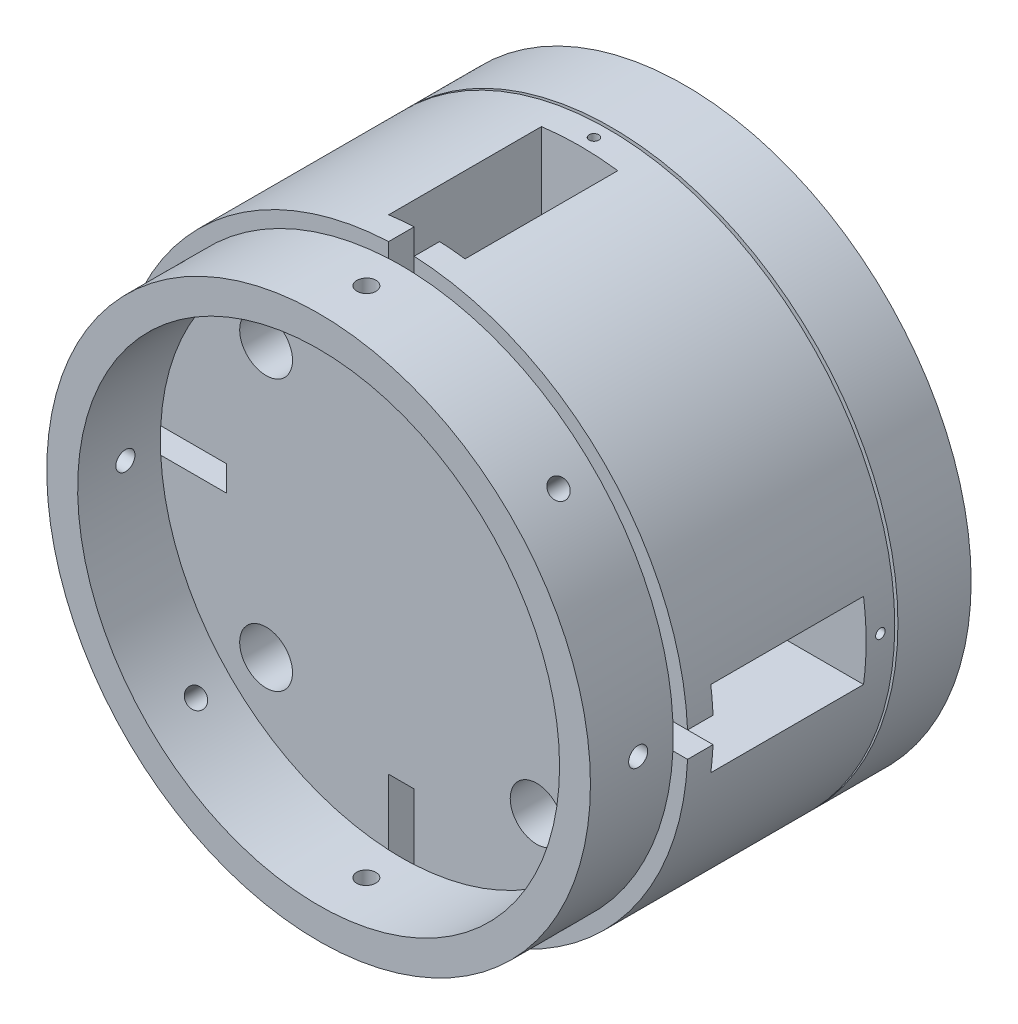
from build123d import *
from build123d.topology import SkipClean

# Parameters (mm, degrees)
SKETCH_1_R                = 45
EXTRUDE_1_DEPTH           = 2.5
EXTRUDE_START             = 26
SKETCH_2_R                = 9
SKETCH_2_R_2              = 4.05
EXTRUDE_2_DEPTH           = 26
CUT_EXTRUDE_4_DEPTH       = 30
CUT_EXTRUDE_4_DEPTH_BACK  = 10
SKETCH_2_5_R              = 4.05
SKETCH_11_R               = 42.7
SKETCH_11_R_2             = 37.85
EXTRUDE_5_DEPTH           = 11
CUT_EXTRUDE_5_DEPTH       = 50
CUT_EXTRUDE_5_DEPTH_BACK  = 50
SKETCH_12_R               = 1.5
CUT_EXTRUDE_6_DEPTH       = 50
CUT_EXTRUDE_6_DEPTH_BACK  = 50
SKETCH_13_R               = 1.5
CUT_EXTRUDE_7_DEPTH       = 50
CUT_EXTRUDE_7_DEPTH_BACK  = 50
SKETCH_18_R               = 1.5
CUT_EXTRUDE_8_DEPTH       = 50
CUT_EXTRUDE_8_DEPTH_BACK  = 50
SKETCH_19_R               = 1.5
EXTRUDE_START_2           = 2
EXTRUDE_7_DEPTH           = 2
EXTRUDE_START_3           = 30
EXTRUDE_8_DEPTH           = 30
SKETCH_29_R               = 45.149779355
EXTRUDE_9_DEPTH           = 4
EXTRUDE_START_4           = 11
SKETCH_30_R               = 42.7
SKETCH_30_R_2             = 37.85
EXTRUDE_10_DEPTH          = 11
SKETCH_31_R               = 47.052447184
SKETCH_31_R_2             = 45
CUT_EXTRUDE_9_DEPTH       = 40
CUT_EXTRUDE_10_DEPTH      = 4
CUT_EXTRUDE_11_DEPTH      = 50
CUT_EXTRUDE_11_DEPTH_BACK = 50
SKETCH_35_R               = 1.5
CUT_EXTRUDE_12_DEPTH      = 50
CUT_EXTRUDE_12_DEPTH_BACK = 50
SKETCH_36_R               = 1.5
CUT_EXTRUDE_13_DEPTH      = 50
CUT_EXTRUDE_13_DEPTH_BACK = 50
SKETCH_37_R               = 1.5
CUT_EXTRUDE_14_DEPTH      = 50
CUT_EXTRUDE_14_DEPTH_BACK = 50
SKETCH_38_R               = 1.5
SKETCH_39_R               = 42.7
SKETCH_39_R_2             = 37.85
EXTRUDE_11_DEPTH          = 1
SKETCH_41_R               = 0.75
SKETCH_41_R_2             = 1
CUT_EXTRUDE_15_DEPTH      = 8
CUT_EXTRUDE_START         = -8
SKETCH_42_R               = 0.75
CUT_EXTRUDE_21_DEPTH      = 8
CUT_EXTRUDE_22_DEPTH      = 8
CUT_EXTRUDE_23_DEPTH      = 8
EXTRUDE_START_5           = -32
EXTRUDE_12_DEPTH          = 32
CUT_EXTRUDE_START_2       = -35
SKETCH_47_R               = 5
CUT_EXTRUDE_24_DEPTH      = 35
SKETCH_49_R               = 4.05
CUT_EXTRUDE_25_DEPTH      = 35
SKETCH_50_R               = 4.15
CUT_EXTRUDE_26_DEPTH      = 50
SKETCH_54_R               = 42.7
SKETCH_54_R_2             = 37.85
EXTRUDE_13_DEPTH          = 2
SKETCH_55_R               = 45
SKETCH_55_R_2             = 43.2
EXTRUDE_14_DEPTH          = 11.5


with BuildPart() as part:
    # 草图1 → 凸台-拉伸1 (new body)
    with BuildSketch(Plane.XY):
        Circle(SKETCH_1_R)
    extrude(amount=-EXTRUDE_1_DEPTH)

    # 草图2 → 凸台-拉伸2 (add)
    # profile 1 of 5: a face of its own
    with BuildSketch(Plane.XY.offset(EXTRUDE_START)):
        with BuildLine():
            ThreePointArc((-44.18993098, 8.5), (-44.411663196, 7.252873374), (-44.598206242, 6))
            Line((-44.598206242, 6), (-25, 6))
            Line((-25, 6), (-25, -6))
            Line((-25, -6), (-44.598206242, -6))
            ThreePointArc((-44.598206242, -6), (-44.411663196, -7.252873374), (-44.18993098, -8.5))
            Line((-44.18993098, -8.5), (-23, -8.5))
            Line((-23, -8.5), (-23, -3))
            Line((-23, -3), (-3, -3))
            Line((-3, -3), (-3, -23))
            Line((-3, -23), (-8.5, -23))
            Line((-8.5, -23), (-8.5, -44.18993098))
            ThreePointArc((-8.5, -44.18993098), (-7.252873374, -44.411663196), (-6, -44.598206242))
            Line((-6, -44.598206242), (-6, -25))
            Line((-6, -25), (6, -25))
            Line((6, -25), (6, -44.598206242))
            ThreePointArc((6, -44.598206242), (7.252873374, -44.411663196), (8.5, -44.18993098))
            Line((8.5, -44.18993098), (8.5, -23))
            Line((8.5, -23), (3, -23))
            Line((3, -23), (3, -3))
            Line((3, -3), (23, -3))
            Line((23, -3), (23, -8.5))
            Line((23, -8.5), (44.18993098, -8.5))
            ThreePointArc((44.18993098, -8.5), (44.411663196, -7.252873374), (44.598206242, -6))
            Line((44.598206242, -6), (25, -6))
            Line((25, -6), (25, 6))
            Line((25, 6), (44.598206242, 6))
            ThreePointArc((44.598206242, 6), (44.411663196, 7.252873374), (44.18993098, 8.5))
            Line((44.18993098, 8.5), (23, 8.5))
            Line((23, 8.5), (23, 3))
            Line((23, 3), (3, 3))
            Line((3, 3), (3, 23))
            Line((3, 23), (8.5, 23))
            Line((8.5, 23), (8.5, 44.18993098))
            ThreePointArc((8.5, 44.18993098), (7.252873374, 44.411663196), (6, 44.598206242))
            Line((6, 44.598206242), (6, 25))
            Line((6, 25), (-6, 25))
            Line((-6, 25), (-6, 44.598206242))
            ThreePointArc((-6, 44.598206242), (-7.252873374, 44.411663196), (-8.5, 44.18993098))
            Line((-8.5, 44.18993098), (-8.5, 23))
            Line((-8.5, 23), (-3, 23))
            Line((-3, 23), (-3, 3))
            Line((-3, 3), (-23, 3))
            Line((-23, 3), (-23, 8.5))
            Line((-23, 8.5), (-44.18993098, 8.5))
        make_face()
    # profile 2 of 5: a face of its own
    with BuildSketch(Plane.XY.offset(EXTRUDE_START)):
        with Locations((-21.25, 21.25)):
            Circle(SKETCH_2_R)
        with Locations((-21.25, 21.25)):
            Circle(SKETCH_2_R_2, mode=Mode.SUBTRACT)
    # profile 3 of 5: a face of its own
    with BuildSketch(Plane.XY.offset(EXTRUDE_START)):
        with Locations((-21.25, -21.25)):
            Circle(SKETCH_2_R)
        with Locations((-21.25, -21.25)):
            Circle(SKETCH_2_R_2, mode=Mode.SUBTRACT)
    # profile 4 of 5: a face of its own
    with BuildSketch(Plane.XY.offset(EXTRUDE_START)):
        with Locations((21.25, 21.25)):
            Circle(SKETCH_2_R)
        with Locations((21.25, 21.25)):
            Circle(SKETCH_2_R_2, mode=Mode.SUBTRACT)
    # profile 5 of 5: a face of its own
    with BuildSketch(Plane.XY.offset(EXTRUDE_START)):
        with Locations((21.25, -21.25)):
            Circle(SKETCH_2_R)
        with Locations((21.25, -21.25)):
            Circle(SKETCH_2_R_2, mode=Mode.SUBTRACT)
    extrude(amount=-EXTRUDE_2_DEPTH)

    # 草图2<5> → 切除-拉伸4 (cut, two sides: drawn at the far end of the back side and taken through both)
    with BuildSketch(Plane.XY.offset(-CUT_EXTRUDE_4_DEPTH_BACK)):
        with Locations((-21.25, 21.25)):
            Circle(SKETCH_2_5_R)
        with Locations((-21.25, -21.25)):
            Circle(SKETCH_2_5_R)
        with Locations((21.25, 21.25)):
            Circle(SKETCH_2_5_R)
        with Locations((21.25, -21.25)):
            Circle(SKETCH_2_5_R)
    extrude(amount=CUT_EXTRUDE_4_DEPTH + CUT_EXTRUDE_4_DEPTH_BACK, mode=Mode.SUBTRACT)

    # 草图11 → 凸台-拉伸5 (add)
    with BuildSketch(Plane(origin=(0, 0, -2.5), x_dir=(-1, 0, 0), z_dir=(0, 0, -1))):
        Circle(SKETCH_11_R)
        Circle(SKETCH_11_R_2, mode=Mode.SUBTRACT)
    extrude(amount=EXTRUDE_5_DEPTH)

    # 草图12 → 切除-拉伸5 (cut, two sides: drawn at the far end of the back side and taken through both)
    with BuildSketch(Plane(origin=(0, 0, 0), x_dir=(1, 0, 0), z_dir=(0, 1, 0)).offset(-CUT_EXTRUDE_5_DEPTH_BACK)):
        with Locations((0, 8.75)):
            Circle(SKETCH_12_R)
    extrude(amount=CUT_EXTRUDE_5_DEPTH + CUT_EXTRUDE_5_DEPTH_BACK, mode=Mode.SUBTRACT)

    # 草图13 → 切除-拉伸6 (cut, two sides: drawn at the far end of the back side and taken through both)
    with BuildSketch(Plane(origin=(0, 0, 0), x_dir=(0, 0, -1), z_dir=(1, 0, 0)).offset(-CUT_EXTRUDE_6_DEPTH_BACK)):
        with Locations((8.75, 0)):
            Circle(SKETCH_13_R)
    extrude(amount=CUT_EXTRUDE_6_DEPTH + CUT_EXTRUDE_6_DEPTH_BACK, mode=Mode.SUBTRACT)

    # 草图18 → 切除-拉伸7 (cut, two sides: drawn at the far end of the back side and taken through both)
    with BuildSketch(Plane(origin=(0, 0, 0), x_dir=(0, 0, 1), z_dir=(0.7071067811865464, 0.7071067811865488, 0)).offset(-CUT_EXTRUDE_7_DEPTH_BACK)):
        with Locations((-8.75, 0)):
            Circle(SKETCH_18_R)
    extrude(amount=CUT_EXTRUDE_7_DEPTH + CUT_EXTRUDE_7_DEPTH_BACK, mode=Mode.SUBTRACT)

    # 草图19 → 切除-拉伸8 (cut, two sides: drawn at the far end of the back side and taken through both)
    with BuildSketch(Plane(origin=(0, 0, 0), x_dir=(0, 0, 1), z_dir=(-0.7071067811865512, 0.7071067811865439, 0)).offset(-CUT_EXTRUDE_8_DEPTH_BACK)):
        with Locations((-8.75, 0)):
            Circle(SKETCH_19_R)
    extrude(amount=CUT_EXTRUDE_8_DEPTH + CUT_EXTRUDE_8_DEPTH_BACK, mode=Mode.SUBTRACT)

    # 草图24 → 凸台-拉伸7 (add)
    with BuildSketch(Plane.XY.offset(EXTRUDE_START_2)):
        with BuildLine():
            Line((-6, 44.598206242), (-6, 25))
            Line((-6, 25), (6, 25))
            Line((6, 25), (6, 44.598206242))
            ThreePointArc((6, 44.598206242), (0, 45), (-6, 44.598206242))
        make_face()
        with BuildLine():
            Line((44.598206242, 6), (25, 6))
            Line((25, 6), (25, -6))
            Line((25, -6), (44.598206242, -6))
            ThreePointArc((44.598206242, -6), (45, 0), (44.598206242, 6))
        make_face()
        with BuildLine():
            Line((6, -44.598206242), (6, -25))
            Line((6, -25), (-6, -25))
            Line((-6, -25), (-6, -44.598206242))
            ThreePointArc((-6, -44.598206242), (0, -45), (6, -44.598206242))
        make_face()
        with BuildLine():
            Line((-44.598206242, -6), (-25, -6))
            Line((-25, -6), (-25, 6))
            Line((-25, 6), (-44.598206242, 6))
            ThreePointArc((-44.598206242, 6), (-45, 0), (-44.598206242, -6))
        make_face()
    extrude(amount=-EXTRUDE_7_DEPTH)

    # 草图26 → 凸台-拉伸8 (add)
    with SkipClean():  # the faces are left unmerged after this step: merging them gives an invalid solid
        with BuildSketch(Plane.XY.offset(EXTRUDE_START_3)):
            with BuildLine():
                Line((-8.5, 42.151512428), (-8.5, 44.18993098))
                ThreePointArc((-8.5, 44.18993098), (-31.819805153, 31.819805153), (-44.18993098, 8.5))
                Line((-44.18993098, 8.5), (-42.151512428, 8.5))
                ThreePointArc((-42.151512428, 8.5), (-30.405591591, 30.405591591), (-8.5, 42.151512428))
            make_face()
            with BuildLine():
                Line((8.5, 42.151512428), (8.5, 44.18993098))
                ThreePointArc((8.5, 44.18993098), (31.819805153, 31.819805153), (44.18993098, 8.5))
                Line((44.18993098, 8.5), (42.151512428, 8.5))
                ThreePointArc((42.151512428, 8.5), (30.405591591, 30.405591591), (8.5, 42.151512428))
            make_face()
            with BuildLine():
                Line((42.151512428, -8.5), (44.18993098, -8.5))
                ThreePointArc((44.18993098, -8.5), (31.819805153, -31.819805153), (8.5, -44.18993098))
                Line((8.5, -44.18993098), (8.5, -42.151512428))
                ThreePointArc((8.5, -42.151512428), (30.405591591, -30.405591591), (42.151512428, -8.5))
            make_face()
            with BuildLine():
                Line((-8.5, -42.151512428), (-8.5, -44.18993098))
                ThreePointArc((-8.5, -44.18993098), (-31.819805153, -31.819805153), (-44.18993098, -8.5))
                Line((-44.18993098, -8.5), (-42.151512428, -8.5))
                ThreePointArc((-42.151512428, -8.5), (-30.405591591, -30.405591591), (-8.5, -42.151512428))
            make_face()
        extrude(amount=-EXTRUDE_8_DEPTH)

    # 草图29 → 凸台-拉伸9 (add)
    with SkipClean():  # the faces are left unmerged after this step: merging them gives an invalid solid
        with BuildSketch(Plane.XY.offset(26)):
            Circle(SKETCH_29_R)
        extrude(amount=EXTRUDE_9_DEPTH)

    # 草图30 → 凸台-拉伸10 (add)
    with SkipClean():  # the faces are left unmerged after this step: merging them gives an invalid solid
        with BuildSketch(Plane.XY.offset(30).offset(EXTRUDE_START_4)):
            Circle(SKETCH_30_R)
            Circle(SKETCH_30_R_2, mode=Mode.SUBTRACT)
        extrude(amount=-EXTRUDE_10_DEPTH)

    # 草图31 → 切除-拉伸9 (cut)
    with SkipClean():  # the faces are left unmerged after this step: merging them gives an invalid solid
        with BuildSketch(Plane.XY.offset(30)):
            Circle(SKETCH_31_R)
            Circle(SKETCH_31_R_2, mode=Mode.SUBTRACT)
        extrude(amount=-CUT_EXTRUDE_9_DEPTH, mode=Mode.SUBTRACT)

    # 草图32 → 切除-拉伸10 (cut)
    with SkipClean():  # the faces are left unmerged after this step: merging them gives an invalid solid
        with BuildSketch(Plane.XY.offset(30)):
            with BuildLine():
                Line((-2, 27.5), (2, 27.5))
                Line((2, 27.5), (2, 44.955533586))
                ThreePointArc((2, 44.955533586), (0, 45), (-2, 44.955533586))
                Line((-2, 44.955533586), (-2, 27.5))
            make_face()
            with BuildLine():
                Line((-44.955533586, -2), (-27.5, -2))
                Line((-27.5, -2), (-27.5, 2))
                Line((-27.5, 2), (-44.955533586, 2))
                ThreePointArc((-44.955533586, 2), (-45, 0), (-44.955533586, -2))
            make_face()
            with BuildLine():
                Line((27.5, -2), (44.955533586, -2))
                ThreePointArc((44.955533586, -2), (45, 0), (44.955533586, 2))
                Line((44.955533586, 2), (27.5, 2))
                Line((27.5, 2), (27.5, -2))
            make_face()
            with BuildLine():
                Line((2, -44.955533586), (2, -27.5))
                Line((2, -27.5), (-2, -27.5))
                Line((-2, -27.5), (-2, -44.955533586))
                ThreePointArc((-2, -44.955533586), (0, -45), (2, -44.955533586))
            make_face()
        extrude(amount=-CUT_EXTRUDE_10_DEPTH, mode=Mode.SUBTRACT)

    # 草图35 → 切除-拉伸11 (cut, two sides: drawn at the far end of the back side and taken through both)
    with SkipClean():  # the faces are left unmerged after this step: merging them gives an invalid solid
        with BuildSketch(Plane(origin=(0, 0, 0), x_dir=(0, 0, -1), z_dir=(1, 0, 0)).offset(-CUT_EXTRUDE_11_DEPTH_BACK)):
            with Locations((-35.5, 0)):
                Circle(SKETCH_35_R)
        extrude(amount=CUT_EXTRUDE_11_DEPTH + CUT_EXTRUDE_11_DEPTH_BACK, mode=Mode.SUBTRACT)

    # 草图36 → 切除-拉伸12 (cut, two sides: drawn at the far end of the back side and taken through both)
    with SkipClean():  # the faces are left unmerged after this step: merging them gives an invalid solid
        with BuildSketch(Plane(origin=(0, 0, 0), x_dir=(1, 0, 0), z_dir=(0, 1, 0)).offset(-CUT_EXTRUDE_12_DEPTH_BACK)):
            with Locations((0, -35.5)):
                Circle(SKETCH_36_R)
        extrude(amount=CUT_EXTRUDE_12_DEPTH + CUT_EXTRUDE_12_DEPTH_BACK, mode=Mode.SUBTRACT)

    # 草图37 → 切除-拉伸13 (cut, two sides: drawn at the far end of the back side and taken through both)
    with SkipClean():  # the faces are left unmerged after this step: merging them gives an invalid solid
        with BuildSketch(Plane(origin=(0, 0, 0), x_dir=(0, 0, 1), z_dir=(0.7071067811865464, 0.7071067811865488, 0)).offset(-CUT_EXTRUDE_13_DEPTH_BACK)):
            with Locations((35.5, 0)):
                Circle(SKETCH_37_R)
        extrude(amount=CUT_EXTRUDE_13_DEPTH + CUT_EXTRUDE_13_DEPTH_BACK, mode=Mode.SUBTRACT)

    # 草图38 → 切除-拉伸14 (cut, two sides: drawn at the far end of the back side and taken through both)
    with SkipClean():  # the faces are left unmerged after this step: merging them gives an invalid solid
        with BuildSketch(Plane(origin=(0, 0, 0), x_dir=(0, 0, 1), z_dir=(-0.7071067811865512, 0.7071067811865439, 0)).offset(-CUT_EXTRUDE_14_DEPTH_BACK)):
            with Locations((35.5, 0)):
                Circle(SKETCH_38_R)
        extrude(amount=CUT_EXTRUDE_14_DEPTH + CUT_EXTRUDE_14_DEPTH_BACK, mode=Mode.SUBTRACT)

    # 草图39 → 凸台-拉伸11 (add)
    with SkipClean():  # the faces are left unmerged after this step: merging them gives an invalid solid
        with BuildSketch(Plane(origin=(0, 0, -13.5), x_dir=(-1, 0, 0), z_dir=(0, 0, -1))):
            Circle(SKETCH_39_R)
            Circle(SKETCH_39_R_2, mode=Mode.SUBTRACT)
        extrude(amount=EXTRUDE_11_DEPTH)

    # 草图41 → 切除-拉伸15 (cut)
    with SkipClean():  # the faces are left unmerged after this step: merging them gives an invalid solid
        with BuildSketch(Plane(origin=(45, 0, 0), x_dir=(0, 0, -1), z_dir=(1, 0, 0))):
            with Locations((0.25, 0)):
                Circle(SKETCH_41_R)
            with Locations((-28.25, 0)):
                Circle(SKETCH_41_R_2)
        extrude(amount=-CUT_EXTRUDE_15_DEPTH, mode=Mode.SUBTRACT)

    # 草图42 → 切除-拉伸21 (cut)
    with SkipClean():  # the faces are left unmerged after this step: merging them gives an invalid solid
        with BuildSketch(Plane.ZY.offset(45).offset(CUT_EXTRUDE_START)):
            with Locations((-0.25, 0)):
                Circle(SKETCH_42_R)
        extrude(amount=CUT_EXTRUDE_21_DEPTH, mode=Mode.SUBTRACT)

    # 草图43 → 切除-拉伸22 (cut)
    with SkipClean():  # the faces are left unmerged after this step: merging them gives an invalid solid
        with BuildSketch(Plane(origin=(0, 45, 0), x_dir=(1, 0, 0), z_dir=(0, 1, 0))):
            with BuildLine():
                ThreePointArc((0, -0.5), (0.530330086, -0.280330086), (0.75, 0.25))
                ThreePointArc((0.75, 0.25), (-0.530330086, 0.780330086), (0, -0.5))
            make_face()
        extrude(amount=-CUT_EXTRUDE_22_DEPTH, mode=Mode.SUBTRACT)

    # 草图44 → 切除-拉伸23 (cut)
    with SkipClean():  # the faces are left unmerged after this step: merging them gives an invalid solid
        with BuildSketch(Plane(origin=(0, -45, 0), x_dir=(-1, 0, 0), z_dir=(0, -1, 0)).offset(CUT_EXTRUDE_START)):
            with BuildLine():
                ThreePointArc((0, -0.5), (0.530330086, -0.280330086), (0.75, 0.25))
                ThreePointArc((0.75, 0.25), (-0.530330086, 0.780330086), (0, -0.5))
            make_face()
        extrude(amount=CUT_EXTRUDE_23_DEPTH, mode=Mode.SUBTRACT)

    # 草图45 → 凸台-拉伸12 (add)
    with SkipClean():  # the faces are left unmerged after this step: merging them gives an invalid solid
        with BuildSketch(Plane(origin=(0, 0, -2.5), x_dir=(-1, 0, 0), z_dir=(0, 0, -1)).offset(EXTRUDE_START_5)):
            with BuildLine():
                ThreePointArc((-17.333536898, 33.64774879), (-18.962002139, 29.445225566), (-17.205349212, 25.294650788))
                ThreePointArc((-17.205349212, 25.294650788), (-10.66660793, 23.99401428), (-6.962708524, 29.537291476))
                ThreePointArc((-6.962708524, 29.537291476), (-8.743494589, 33.803230266), (-13.028786446, 35.536927607))
                ThreePointArc((-13.028786446, 35.536927607), (-15.210520006, 34.659235149), (-17.333536898, 33.64774879))
            make_face()
            with BuildLine():
                ThreePointArc((-7.962708524, 29.537291476), (-11.049291363, 24.917893813), (-16.49824243, 26.00175757))
                ThreePointArc((-16.49824243, 26.00175757), (-14.876125686, 34.156689138), (-7.962708524, 29.537291476))
            make_face(mode=Mode.SUBTRACT)
        extrude(amount=EXTRUDE_12_DEPTH)

    # 草图47 → 切除-拉伸24 (cut)
    with SkipClean():  # the faces are left unmerged after this step: merging them gives an invalid solid
        with BuildSketch(Plane(origin=(0, 0, -2.5), x_dir=(-1, 0, 0), z_dir=(0, 0, -1)).offset(CUT_EXTRUDE_START_2)):
            with Locations((-12.962708524, 29.537291476)):
                Circle(SKETCH_47_R)
        extrude(amount=CUT_EXTRUDE_24_DEPTH, mode=Mode.SUBTRACT)

    # 草图49 → 切除-拉伸25 (cut)
    with SkipClean():  # the faces are left unmerged after this step: merging them gives an invalid solid
        with BuildSketch(Plane(origin=(0, 0, -2.5), x_dir=(-1, 0, 0), z_dir=(0, 0, -1)).offset(CUT_EXTRUDE_START_2)):
            with Locations((-21.25, 21.25)):
                Circle(SKETCH_49_R)
            with Locations((-21.25, -21.25)):
                Circle(SKETCH_49_R)
            with Locations((21.25, -21.25)):
                Circle(SKETCH_49_R)
            with Locations((21.25, 21.25)):
                Circle(SKETCH_49_R)
        extrude(amount=CUT_EXTRUDE_25_DEPTH, mode=Mode.SUBTRACT)

    # 草图50 → 切除-拉伸26 (cut)
    with SkipClean():  # the faces are left unmerged after this step: merging them gives an invalid solid
        with BuildSketch(Plane(origin=(0, 0, -2.5), x_dir=(-1, 0, 0), z_dir=(0, 0, -1))):
            with Locations((-21.25, 21.25)):
                Circle(SKETCH_50_R)
            with Locations((21.25, 21.25)):
                Circle(SKETCH_50_R)
            with Locations((-21.25, -21.25)):
                Circle(SKETCH_50_R)
            with Locations((21.25, -21.25)):
                Circle(SKETCH_50_R)
        extrude(amount=-CUT_EXTRUDE_26_DEPTH, mode=Mode.SUBTRACT)

    # 草图54 → 凸台-拉伸13 (add)
    with SkipClean():  # the faces are left unmerged after this step: merging them gives an invalid solid
        with BuildSketch(Plane.XY.offset(41).offset(EXTRUDE_START_2)):
            Circle(SKETCH_54_R)
            Circle(SKETCH_54_R_2, mode=Mode.SUBTRACT)
        extrude(amount=-EXTRUDE_13_DEPTH)


with BuildPart() as body_2:
    # 草图55 → 凸台-拉伸14 (new body)
    with BuildSketch(Plane(origin=(0, 0, -14.5), x_dir=(-1, 0, 0), z_dir=(0, 0, -1))):
        Circle(SKETCH_55_R)
        Circle(SKETCH_55_R_2, mode=Mode.SUBTRACT)
    extrude(amount=-EXTRUDE_14_DEPTH)


solid = Compound([part.part, body_2.part])
